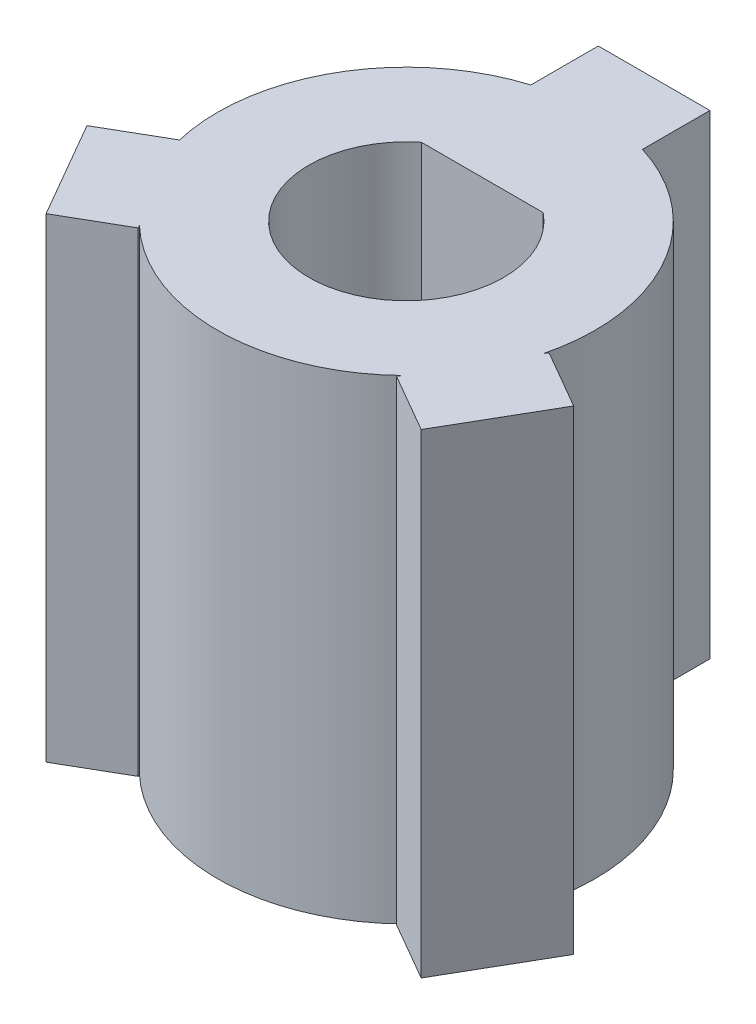
from build123d import *

# Parameters (mm, degrees)
SKIZZE1_R                       = 3.975
AUFSATZ_LINEAR_AUSTRAGEN1_DEPTH = 10
SCHNITT_LINEAR_AUSTRAGEN1_DEPTH = 10
SKIZZE4_W                       = 2.35
SKIZZE4_H                       = 1.42
AUFSATZ_LINEAR_AUSTRAGEN3_DEPTH = 10


with BuildPart() as part:
    # Skizze1 → Aufsatz-Linear austragen1 (new body)
    with BuildSketch(Plane(origin=(0, 0, 0), x_dir=(1, 0, 0), z_dir=(0, 1, 0))):
        Circle(SKIZZE1_R)
    extrude(amount=AUFSATZ_LINEAR_AUSTRAGEN1_DEPTH)

    # Skizze2 → Schnitt-Linear austragen1 (cut)
    with BuildSketch(Plane(origin=(0, 10, 0), x_dir=(1, 0, 0), z_dir=(0, 1, 0))):
        with BuildLine():
            Line((-1.281600562, 1.6), (1.281600562, 1.6))
            ThreePointArc((1.281600562, 1.6), (0, -2.05), (-1.281600562, 1.6))
        make_face()
    extrude(amount=-SCHNITT_LINEAR_AUSTRAGEN1_DEPTH, mode=Mode.SUBTRACT)

    # Skizze4 → Aufsatz-Linear austragen3 (add)
    with BuildSketch(Plane(origin=(0, 10, 0), x_dir=(1, 0, 0), z_dir=(0, 1, 0))):
        with Locations((0, 4.507367509)):
            Rectangle(SKIZZE4_W, SKIZZE4_H)
        Polygon((5.128633346, -1.60424471), (3.898877272, -0.89424471), (2.723877272, -2.929404409), (3.953633346, -3.639404409), align=None)
        Polygon((-3.930872804, -3.652545214), (-2.70111673, -2.942545214), (-3.87611673, -0.907385515), (-5.105872804, -1.617385515), align=None)
    extrude(amount=-AUFSATZ_LINEAR_AUSTRAGEN3_DEPTH)


solid = part.part
